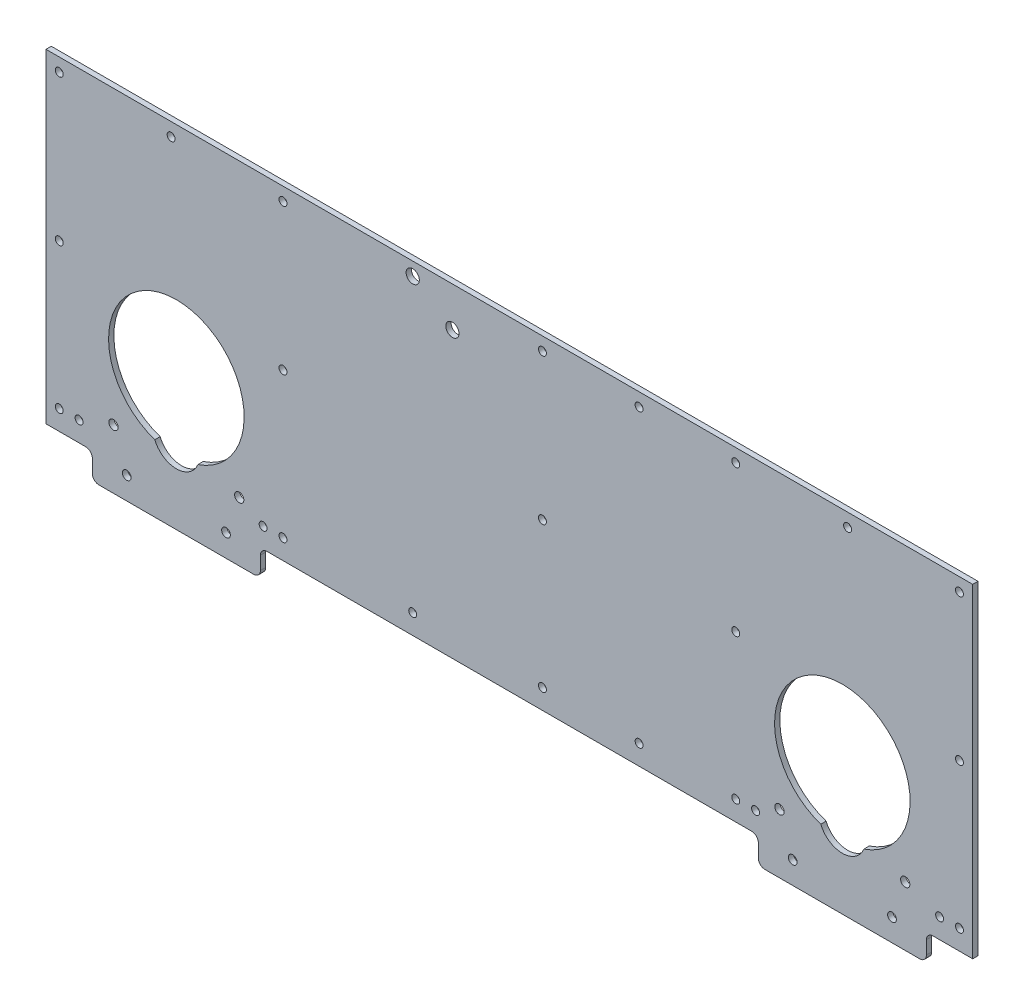
from build123d import *

# Parameters (mm, degrees)
BOSS_EXTRUDE1_DEPTH = 4
SKETCH2_R           = 3.5
SKETCH2_R_2         = 3.302
CUT_EXTRUDE1_DEPTH  = 378.918311279
SKETCH5_R           = 3
SKETCH5_R_2         = 5
CUT_EXTRUDE2_DEPTH  = 378.918311279


with BuildPart() as part:
    # Sketch1 → Boss-Extrude1 (new body)
    with BuildSketch(Plane.XY):
        with BuildLine():
            Line((-350, 122.5), (350, 122.5))
            Line((350, 122.5), (350, -122.5))
            Line((350, -122.5), (320, -122.5))
            ThreePointArc((320, -122.5), (316.464466094, -123.964466094), (315, -127.5))
            Line((315, -127.5), (315, -137.5))
            ThreePointArc((315, -137.5), (313.535533906, -141.035533906), (310, -142.5))
            Line((310, -142.5), (193.06, -142.5))
            ThreePointArc((193.06, -142.5), (189.524466094, -141.035533906), (188.06, -137.5))
            Line((188.06, -137.5), (188.06, -127.5))
            ThreePointArc((188.06, -127.5), (186.595533906, -123.964466094), (183.06, -122.5))
            Line((183.06, -122.5), (-183.06, -122.5))
            ThreePointArc((-183.06, -122.5), (-186.595533906, -123.964466094), (-188.06, -127.5))
            Line((-188.06, -127.5), (-188.06, -137.5))
            ThreePointArc((-188.06, -137.5), (-189.524466094, -141.035533906), (-193.06, -142.5))
            Line((-193.06, -142.5), (-310, -142.5))
            ThreePointArc((-310, -142.5), (-313.535533906, -141.035533906), (-315, -137.5))
            Line((-315, -137.5), (-315, -127.5))
            ThreePointArc((-315, -127.5), (-316.464466094, -123.964466094), (-320, -122.5))
            Line((-320, -122.5), (-350, -122.5))
            Line((-350, -122.5), (-350, 122.5))
        make_face()
    extrude(amount=BOSS_EXTRUDE1_DEPTH)

    # Sketch2 → Cut-Extrude1 (cut, through all)
    with BuildSketch(Plane.XY.offset(4)):
        with Locations((-299.029618848, -97.636758765)):
            Circle(SKETCH2_R)
        with Locations((-204.029618848, -97.636758765)):
            Circle(SKETCH2_R)
        with Locations((-289.030381152, -125.636758765)):
            Circle(SKETCH2_R_2)
        with Locations((-214.030381152, -125.636758765)):
            Circle(SKETCH2_R_2)
        with Locations((204.02961885, -97.636758765)):
            Circle(SKETCH2_R)
        with Locations((299.02961885, -97.636758765)):
            Circle(SKETCH2_R)
        with Locations((214.028856546, -125.636758765)):
            Circle(SKETCH2_R_2)
        with Locations((289.028856546, -125.636758765)):
            Circle(SKETCH2_R_2)
        with BuildLine():
            ThreePointArc((-235.273778228, -91.777635644), (-251.529618848, 7.973241235), (-267.785459469, -91.777635644))
            ThreePointArc((-267.785459469, -91.777635644), (-251.529618848, -102.696758765), (-235.273778228, -91.777635644))
        make_face()
        with BuildLine():
            ThreePointArc((267.78545947, -91.777635644), (251.52961885, 7.973241235), (235.27377823, -91.777635644))
            ThreePointArc((235.27377823, -91.777635644), (251.52961885, -102.696758765), (267.78545947, -91.777635644))
        make_face()
    extrude(amount=-CUT_EXTRUDE1_DEPTH, mode=Mode.SUBTRACT)

    # Sketch5 → Cut-Extrude2 (cut, through all)
    with BuildSketch(Plane.XY.offset(4)):
        with Locations((-340, -107.5)):
            Circle(SKETCH5_R)
        with Locations((-340, 112.5)):
            Circle(SKETCH5_R)
        with Locations((-171, 112.5)):
            Circle(SKETCH5_R)
        with Locations((-171, -107.5)):
            Circle(SKETCH5_R)
        with Locations((171, -107.5)):
            Circle(SKETCH5_R)
        with Locations((340, 112.5)):
            Circle(SKETCH5_R)
        with Locations((340, -107.5)):
            Circle(SKETCH5_R)
        with Locations((171, 112.5)):
            Circle(SKETCH5_R)
        with Locations((25, 112.5)):
            Circle(SKETCH5_R)
        with Locations((25, -107.5)):
            Circle(SKETCH5_R)
        with Locations((-255.5, 112.5)):
            Circle(SKETCH5_R)
        with Locations((98, 112.5)):
            Circle(SKETCH5_R)
        with Locations((255.5, 112.5)):
            Circle(SKETCH5_R)
        with Locations((340, 2.25)):
            Circle(SKETCH5_R)
        with Locations((171, 2)):
            Circle(SKETCH5_R)
        with Locations((25, 2.25)):
            Circle(SKETCH5_R)
        with Locations((-171, 2.25)):
            Circle(SKETCH5_R)
        with Locations((-340, 2.25)):
            Circle(SKETCH5_R)
        with Locations((-73, 112.5)):
            Circle(SKETCH5_R_2)
        with Locations((-73, -107.5)):
            Circle(SKETCH5_R)
        with Locations((-325, -107.5)):
            Circle(SKETCH5_R)
        with Locations((186, -107.5)):
            Circle(SKETCH5_R)
        with Locations((325, -107.5)):
            Circle(SKETCH5_R)
        with Locations((-186, -107.5)):
            Circle(SKETCH5_R)
        with Locations((98, -107.5)):
            Circle(SKETCH5_R)
        with Locations((-43, 92.5)):
            Circle(SKETCH5_R_2)
    extrude(amount=-CUT_EXTRUDE2_DEPTH, mode=Mode.SUBTRACT)


solid = part.part
